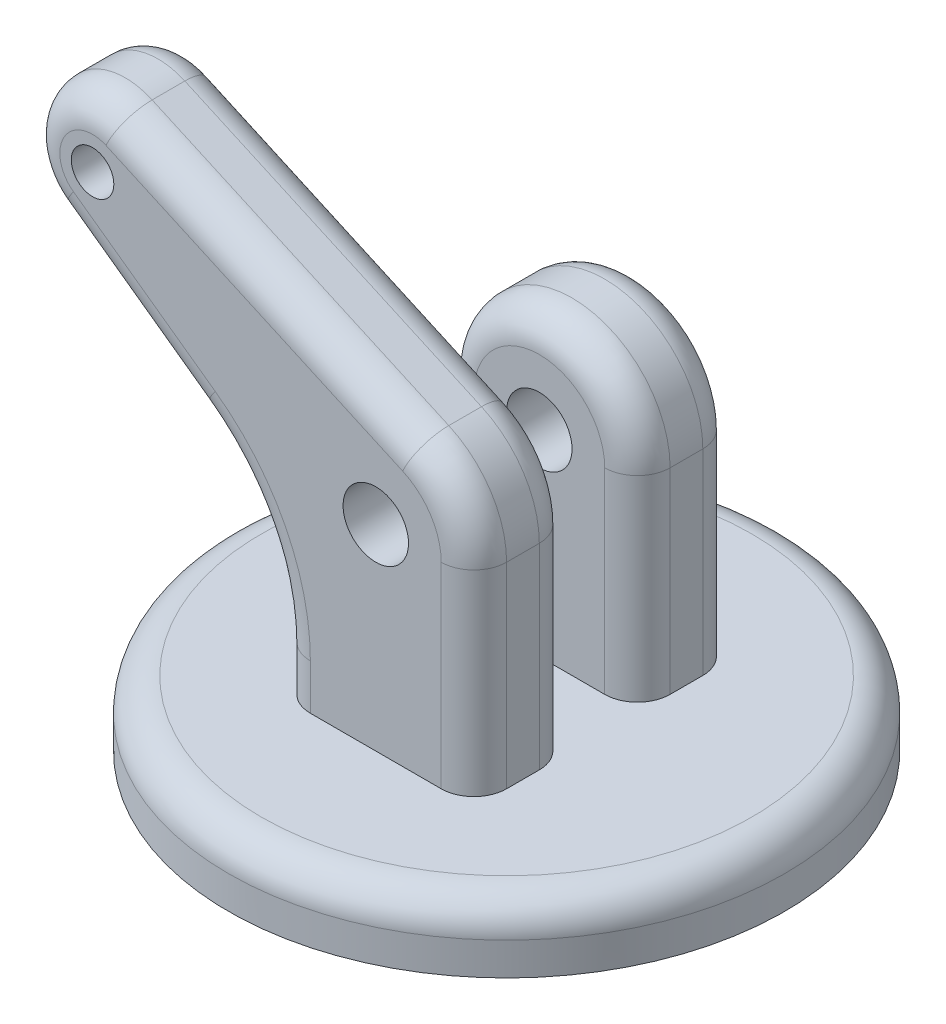
from build123d import *
from build123d.topology import SkipClean

# Parameters (mm, degrees)
SKETCH1_W           = 40
SKETCH1_H           = 60
BOSS_EXTRUDE1_DEPTH = 10
SKETCH2_W           = 30
SKETCH2_H           = 40
BOSS_EXTRUDE2_DEPTH = 40
SKETCH6_R           = 15
SKETCH6_R_2         = 5
BOSS_EXTRUDE4_DEPTH = 20
SKETCH7_R           = 5
CUT_EXTRUDE2_DEPTH  = 30
CUT_EXTRUDE3_START  = 10
SKETCH8_W           = 30
SKETCH8_H           = 10
CUT_EXTRUDE3_DEPTH  = 50
BOSS_EXTRUDE5_START = 20
SKETCH10_R          = 3.25
BOSS_EXTRUDE5_DEPTH = 15
FILLET1_R           = 30
FILLET2_R           = 5
FILLET3_R           = 5
FILLET4_R           = 5
FILLET5_R           = 5
SCALE_1_SCALE       = 2
SKETCH_1_R          = 85
EXTRUDE_1_DEPTH     = 20
FILLET_1_R          = 10


# Some blends are built 0.0001 mm under size
with BuildPart() as part:
    # Sketch1 → Boss-Extrude1 (new body)
    with BuildSketch(Plane(origin=(0, 0, 0), x_dir=(1, 0, 0), z_dir=(0, 1, 0))):
        Rectangle(SKETCH1_W, SKETCH1_H)
    extrude(amount=BOSS_EXTRUDE1_DEPTH)

    # Sketch2 → Boss-Extrude2 (add)
    with BuildSketch(Plane(origin=(0, 0, 0), x_dir=(1, 0, 0), z_dir=(0, 1, 0))):
        Rectangle(SKETCH2_W, SKETCH2_H)
    extrude(amount=BOSS_EXTRUDE2_DEPTH)

    # Sketch6 → Boss-Extrude4 (add, symmetric)
    with BuildSketch(Plane.XY):
        with Locations((0, 40)):
            Circle(SKETCH6_R)
        with Locations((0, 40)):
            Circle(SKETCH6_R_2, mode=Mode.SUBTRACT)
    extrude(amount=BOSS_EXTRUDE4_DEPTH, both=True)

    # Sketch7 → Cut-Extrude2 (cut, symmetric)
    with SkipClean():  # the faces are left unmerged after this step: merging them gives an invalid solid
        with BuildSketch(Plane.XY):
            with Locations((0, 40)):
                Circle(SKETCH7_R)
        extrude(amount=CUT_EXTRUDE2_DEPTH, both=True, mode=Mode.SUBTRACT)

    # Sketch8 → Cut-Extrude3 (cut)
    with BuildSketch(Plane(origin=(0, 0, 0), x_dir=(1, 0, 0), z_dir=(0, 1, 0)).offset(CUT_EXTRUDE3_START)):
        Rectangle(SKETCH8_W, SKETCH8_H)
    extrude(amount=CUT_EXTRUDE3_DEPTH, mode=Mode.SUBTRACT)

    # Sketch10 → Boss-Extrude5 (add)
    with BuildSketch(Plane.XY.offset(BOSS_EXTRUDE5_START)):
        with BuildLine():
            Line((-49.142232779, 56.88315603), (-8.761443884, 27.824734045))
            ThreePointArc((-8.761443884, 27.824734045), (-12.990381057, 47.5), (6.163367673, 53.675265955))
            Line((6.163367673, 53.675265955), (-39.192358407, 74.11684397))
            ThreePointArc((-39.192358407, 74.11684397), (-51.961524227, 70), (-49.142232779, 56.88315603))
        make_face()
        with Locations((-43.301270189, 65)):
            Circle(SKETCH10_R, mode=Mode.SUBTRACT)
    extrude(amount=-BOSS_EXTRUDE5_DEPTH)

    # Fillet1
    fillet1_edges = [part.edges().sort_by_distance(p)[0] for p in [
        (-15, 32.314061796, 12.5),
    ]]
    fillet(fillet1_edges, radius=FILLET1_R)

    # Fillet2
    fillet2_edges = [part.edges().sort_by_distance(p)[0] for p in [
        (-38.309672505, 49.087936664, 20),
        (-38.309672505, 49.087936664, 5),
        (-18.300874237, 30.622707436, 5),
        (-18.300874237, 30.622707436, 20),
        (15, 25, 20),
        (12.598621256, 48.140930073, 20),
        (15, 25, 5),
        (12.598621256, 48.140930073, 5),
        (-51.961524227, 70, 20),
        (-16.514495367, 63.896054962, 5),
        (-51.961524227, 70, 5),
        (-16.514495367, 63.896054962, 20),
        (-15, 13.471092695, 20),
        (-15, 13.471092695, 5),
    ]]
    fillet(fillet2_edges, radius=FILLET2_R)

    # Fillet3
    fillet3_edges = [part.edges().sort_by_distance(p)[0] for p in [
        (15, 25, -20),
        (-15, 25, -20),
        (0, 55, -20),
        (-15, 25, -5),
        (0, 55, -5),
        (15, 25, -5),
    ]]
    fillet(fillet3_edges, radius=FILLET3_R)

    # Fillet4
    fillet4_edges = [part.edges().sort_by_distance(p)[0] for p in [
        (-20, 10, 0),
        (0, 10, 30),
        (20, 10, 0),
        (0, 10, -30),
    ]]
    fillet(fillet4_edges, radius=FILLET4_R - 0.0001)  # a hair under: the kernel refuses the full size

    # Fillet5
    # the kernel refuses this fillet: 5 mm, written as the material it takes off along each edge
    with BuildSketch(Plane(origin=(15, 10, 25), x_dir=(0, 0, 1), z_dir=(-1, 0, 0))) as fillet5_piece_1:
        with BuildLine():
            CenterArc((0.0001, -4.9999), 4.9999, 0, 90)
            Line((5, -4.9999), (5, 0))
            Line((5, 0), (0.0001, 0))
        make_face()
    revolve(axis=Axis((15, 10, 25), (0, 1, 0)), revolution_arc=90, mode=Mode.SUBTRACT)
    with BuildSketch(Plane(origin=(-15, 10, 25), x_dir=(-1, 0, 0), z_dir=(0, 0, -1))) as fillet5_piece_2:
        with BuildLine():
            CenterArc((0.0001, -4.9999), 4.9999, 0, 90)
            Line((5, -4.9999), (5, 0))
            Line((5, 0), (0.0001, 0))
        make_face()
    revolve(axis=Axis((-15, 10, 25), (0, 1, 0)), revolution_arc=90, mode=Mode.SUBTRACT)
    with BuildSketch(Plane(origin=(15, 10, -25), x_dir=(1, 0, 0), z_dir=(0, 0, 1))) as fillet5_piece_3:
        with BuildLine():
            CenterArc((0.0001, -4.9999), 4.9999, 0, 90)
            Line((5, -4.9999), (5, 0))
            Line((5, 0), (0.0001, 0))
        make_face()
    revolve(axis=Axis((15, 10, -25), (0, 1, 0)), revolution_arc=90, mode=Mode.SUBTRACT)
    with BuildSketch(Plane(origin=(-15, 10, -25), x_dir=(0, 0, -1), z_dir=(1, 0, 0))) as fillet5_piece_4:
        with BuildLine():
            CenterArc((0.0001, -4.9999), 4.9999, 0, 90)
            Line((5, -4.9999), (5, 0))
            Line((5, 0), (0.0001, 0))
        make_face()
    revolve(axis=Axis((-15, 10, -25), (0, 1, 0)), revolution_arc=90, mode=Mode.SUBTRACT)
    with BuildSketch(Plane(origin=(-20, -12.5, -30), x_dir=(0, 0, 1), z_dir=(0, 1, 0)), Plane(origin=(20, -12.5, -30), x_dir=(-1, 0, 0), z_dir=(0, 1, 0))) as fillet5_piece_5:
        with BuildLine():
            CenterArc((FILLET5_R, FILLET5_R), FILLET5_R, 180, 90)
            Line((0, FILLET5_R), (0, 0))
            Line((0, 0), (FILLET5_R, 0))
        make_face()
    extrude(amount=22.5, mode=Mode.SUBTRACT)
    with BuildSketch(Plane(origin=(20, -12.5, 30), x_dir=(-1, 0, 0), z_dir=(0, 1, 0)), Plane(origin=(-20, -12.5, 30), x_dir=(0, 0, -1), z_dir=(0, 1, 0))) as fillet5_piece_6:
        with BuildLine():
            CenterArc((FILLET5_R, -FILLET5_R), FILLET5_R, 90, 90)
            Line((0, -FILLET5_R), (0, 0))
            Line((0, 0), (FILLET5_R, 0))
        make_face()
    extrude(amount=22.5, mode=Mode.SUBTRACT)


with BuildPart() as part_1:
    # 缩放比例1: scaled about (-5.855669763, 27.313859585, 2.636754643)
    add(part.part.scale(SCALE_1_SCALE).moved(Location((5.855669763, -27.313859585, -2.636754643))))

    # 草图1 → 凸台-拉伸1 (add)
    with BuildSketch(Plane.XZ.offset(27.313870031)):
        with Locations(Location((5.855672976, -2.63675609, 0), (0, 0, 270))):
            Circle(SKETCH_1_R)
    extrude(amount=-EXTRUDE_1_DEPTH)

    # 圆角1
    fillet_1_edges = [part_1.edges().sort_by_distance(p)[0] for p in [
        (5.855672976, -7.313870031, 82.36324391),
    ]]
    fillet(fillet_1_edges, radius=FILLET_1_R)


solid = part_1.part
